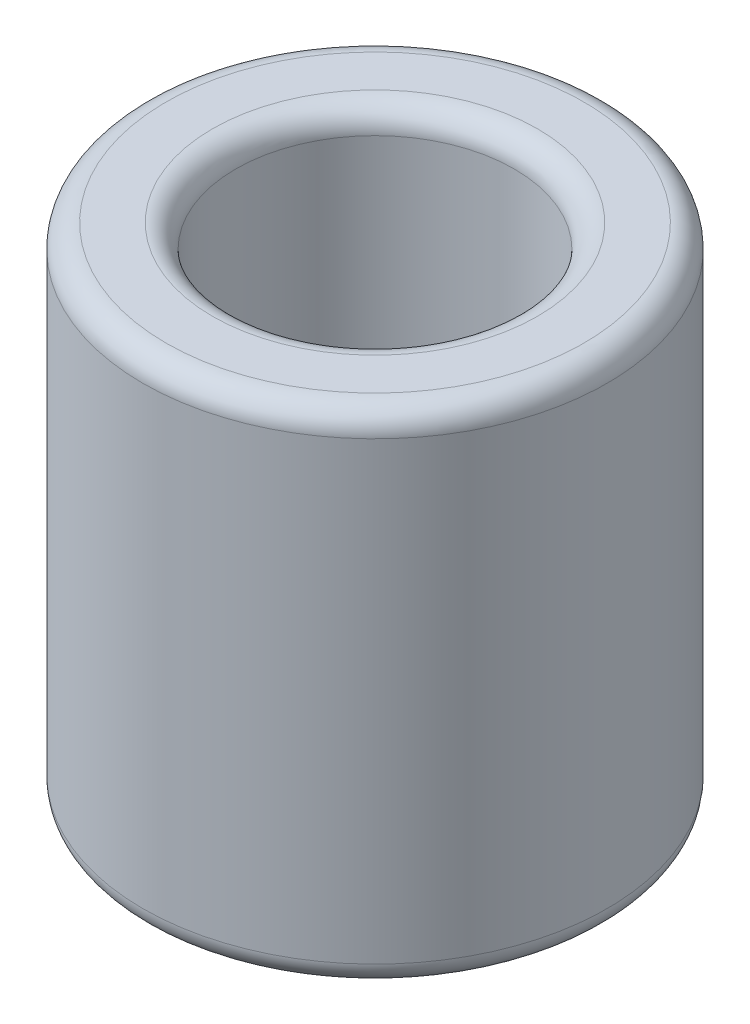
from build123d import *

# Parameters (mm, degrees)
SKETCH1_R           = 2.5
SKETCH1_R_2         = 1.5
BOSS_EXTRUDE1_DEPTH = 5.4
FILLET1_R           = 0.25


with BuildPart() as part:
    # Sketch1 → Boss-Extrude1 (new body)
    with BuildSketch(Plane(origin=(0, 0, 0), x_dir=(1, 0, 0), z_dir=(0, 1, 0))):
        Circle(SKETCH1_R)
        Circle(SKETCH1_R_2, mode=Mode.SUBTRACT)
    extrude(amount=BOSS_EXTRUDE1_DEPTH)

    # Fillet1
    fillet1_edges = [part.edges().sort_by_distance(p)[0] for p in [
        (-1.5, 0, 0),
        (-1.5, 5.4, 0),
        (-2.5, 0, 0),
        (-2.5, 5.4, 0),
    ]]
    fillet(fillet1_edges, radius=FILLET1_R)


solid = part.part
